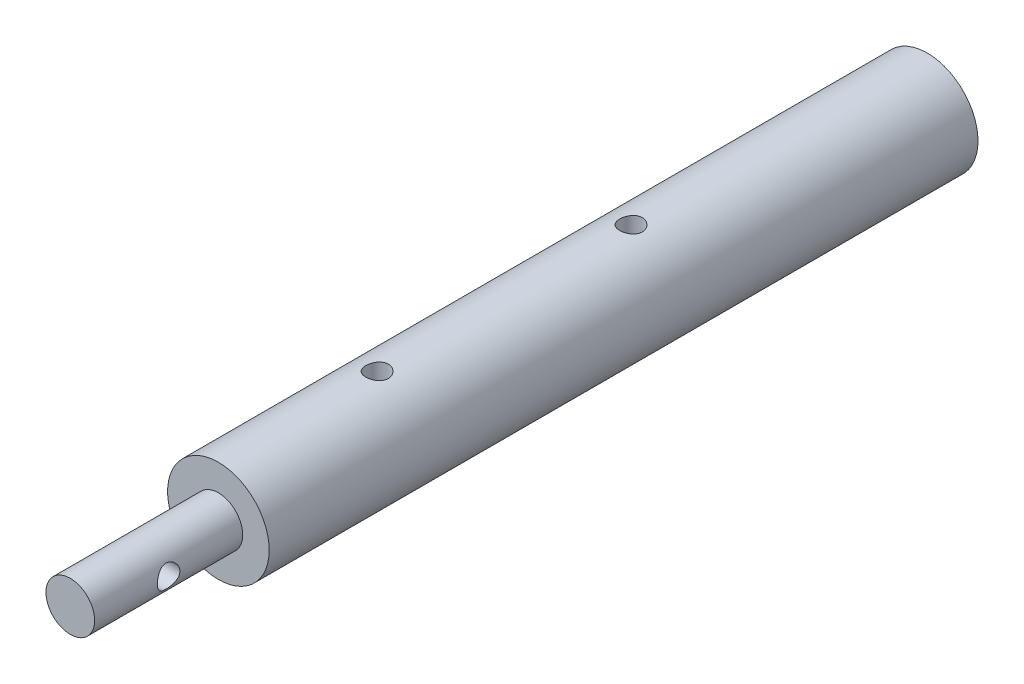
from build123d import *

# Parameters (mm, degrees)
SKETCH1_R             = 6.096
BOSS_EXTRUDE1_DEPTH   = 85.09
SKETCH2_R             = 2.921
BOSS_EXTRUDE2_DEPTH   = 17.78
F_6_32_TAPPED_HOLE1_D = 2.7051
F_6_32_TAPPED_HOLE2_D = 2.7051


with BuildPart() as part:
    # Sketch1 → Boss-Extrude1 (new body)
    with BuildSketch(Plane.XY):
        Circle(SKETCH1_R)
    extrude(amount=BOSS_EXTRUDE1_DEPTH)

    # Sketch2 → Boss-Extrude2 (add)
    with BuildSketch(Plane.XY.offset(85.09)):
        Circle(SKETCH2_R)
    extrude(amount=BOSS_EXTRUDE2_DEPTH)

    # #6-32 Tapped Hole1 (through all)
    with Locations(Plane(origin=(0, 6.096, 0), x_dir=(1, 0, 0), z_dir=(0, 1, 0))):
        with Locations((0, -35.56), (0, -66.04)):
            Hole(F_6_32_TAPPED_HOLE1_D / 2)

    # #6-32 Tapped Hole2 (through all)
    with Locations(Plane(origin=(2.921, 0, 0), x_dir=(0, 0, -1), z_dir=(1, 0, 0))):
        with Locations((-93.98, 0)):
            Hole(F_6_32_TAPPED_HOLE2_D / 2)


solid = part.part
